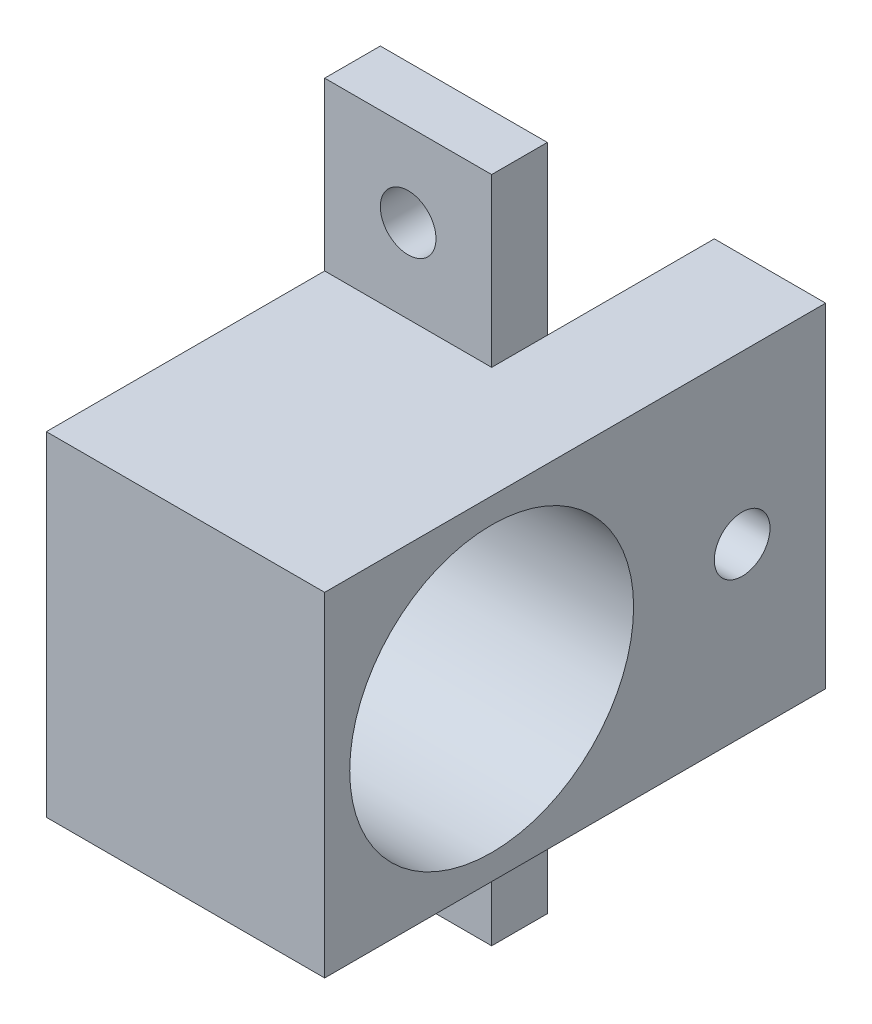
from build123d import *

# Parameters (mm, degrees)
SKETCH1_W           = 30
SKETCH1_H           = 15
BOSS_EXTRUDE1_DEPTH = 30
SKETCH2_W           = 30
SKETCH2_H           = 45
BOSS_EXTRUDE2_DEPTH = 10
SKETCH5_R           = 2.5
CUT_EXTRUDE2_DEPTH  = 50.244289009
SKETCH3_R           = 12.75
CUT_EXTRUDE3_DEPTH  = 50.244289009
SKETCH8_W           = 15
SKETCH8_H           = 15
SKETCH8_R           = 2.5
BOSS_EXTRUDE4_DEPTH = 5


with BuildPart() as part:
    # Sketch1 → Boss-Extrude1 (new body)
    with BuildSketch(Plane(origin=(0, 0, 0), x_dir=(0, 1, 0), z_dir=(0, 0, 1))):
        with Locations((15, 7.5)):
            Rectangle(SKETCH1_W, SKETCH1_H)
    extrude(amount=BOSS_EXTRUDE1_DEPTH)

    # Sketch2 → Boss-Extrude2 (add)
    with BuildSketch(Plane.YZ):
        with Locations((15, 7.5)):
            Rectangle(SKETCH2_W, SKETCH2_H)
    extrude(amount=BOSS_EXTRUDE2_DEPTH)

    # Sketch5 → Cut-Extrude2 (cut, through all)
    with BuildSketch(Plane.YZ.offset(10)):
        with Locations((15, -7.5)):
            Circle(SKETCH5_R)
    extrude(amount=-CUT_EXTRUDE2_DEPTH, mode=Mode.SUBTRACT)

    # Sketch3 → Cut-Extrude3 (cut, through all)
    with BuildSketch(Plane.YZ.offset(10)):
        with Locations((15, 15)):
            Circle(SKETCH3_R)
    extrude(amount=-CUT_EXTRUDE3_DEPTH, mode=Mode.SUBTRACT)

    # Sketch8 → Boss-Extrude4 (add)
    # profile 1 of 2: a face of its own
    with BuildSketch(Plane(origin=(0, 0, 0), x_dir=(1, 0, 0), z_dir=(0, 0, -1))):
        with Locations((-7.5, -37.5)):
            Rectangle(SKETCH8_W, SKETCH8_H)
        with Locations((-7.5, -37.5)):
            Circle(SKETCH8_R, mode=Mode.SUBTRACT)
    # profile 2 of 2: a face of its own
    with BuildSketch(Plane(origin=(0, 0, 0), x_dir=(1, 0, 0), z_dir=(0, 0, -1))):
        with Locations((-7.5, 7.5)):
            Rectangle(SKETCH8_W, SKETCH8_H)
        with Locations((-7.5, 7.5)):
            Circle(SKETCH8_R, mode=Mode.SUBTRACT)
    extrude(amount=-BOSS_EXTRUDE4_DEPTH)


solid = part.part
